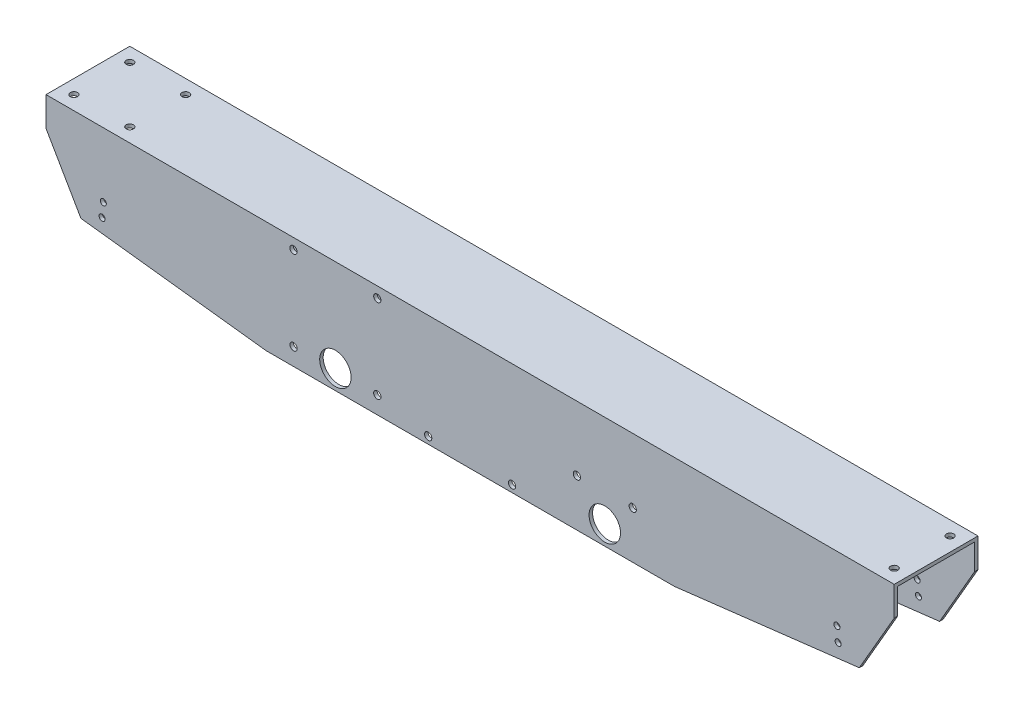
from build123d import *

# Parameters (mm, degrees)
BOSS_EXTRUDE1_DEPTH                     = 385.705756272
SKETCH2_R                               = 2.749999961
SKETCH2_R_2                             = 2.75
SKETCH2_R_3                             = 3.302
SKETCH2_R_4                             = 14.2875
AXLES_DEPTH                             = 141.732
FLANIGAN_MOUNTING_HOLES_R               = 3.3
FLANIGAN_MOUNTING_HOLES_EXTRUSION_DEPTH = 397.429073633
BEVELED_ENDS_DEPTH                      = 101.6
SKETCH32_R                              = 3.3
BELT_SHIELD_HOLES_DEPTH                 = 397.429073633
SKETCH37_R                              = 3.3
TOP_HOLES_DEPTH                         = 401.678300412


with BuildPart() as part:
    # Sketch1 → Boss-Extrude1 (new, symmetric)
    with BuildSketch(Plane(origin=(0, 0, 0), x_dir=(0, 0, -1), z_dir=(1, 0, 0))):
        Polygon((-38.1, 50.8), (38.1, 50.8), (38.1, -50.8), (34.925, -50.8), (34.925, 47.625), (-34.925, 47.625), (-34.925, -50.8), (-38.1, -50.8), align=None)
    extrude(amount=BOSS_EXTRUDE1_DEPTH, both=True)

    # Sketch2 → Axles (cut)
    with BuildSketch(Plane.XY.offset(38.1)):
        with Locations((-333.577237048, -7.874)):
            Circle(SKETCH2_R)
        with Locations((334.720333616, -20.574)):
            Circle(SKETCH2_R_2)
        with Locations((333.577237048, -7.874)):
            Circle(SKETCH2_R)
        with Locations((-160.6, -35.12)):
            Circle(SKETCH2_R_3)
        with Locations((-160.6, 41.08)):
            Circle(SKETCH2_R_3)
        with Locations((-122.5, -33.274)):
            Circle(SKETCH2_R_4)
        with Locations((-334.720333616, -20.574)):
            Circle(SKETCH2_R_2)
        with Locations((-84.4, 41.08)):
            Circle(SKETCH2_R_3)
        with Locations((-84.4, -35.12)):
            Circle(SKETCH2_R_3)
        with Locations((122.5, -33.274)):
            Circle(SKETCH2_R_4)
    extrude(amount=-AXLES_DEPTH, mode=Mode.SUBTRACT)

    # Flanigan mounting holes → Flanigan mounting holes extrusion (cut, through all)
    with BuildSketch(Plane.XY.offset(38.1)):
        with Locations((97.1, -7.87)):
            Circle(FLANIGAN_MOUNTING_HOLES_R)
        with Locations((147.9, -7.87)):
            Circle(FLANIGAN_MOUNTING_HOLES_R)
    extrude(amount=-FLANIGAN_MOUNTING_HOLES_EXTRUSION_DEPTH, mode=Mode.SUBTRACT)

    # Sketch16 → Beveled ends (cut)
    with BuildSketch(Plane.XY.offset(38.1)):
        Polygon((-353.951491467, -30.8), (-185.705756272, -50.8), (-385.705756272, -50.8), (-385.705756272, 24.2), align=None)
        Polygon((385.705756272, -50.8), (185.705756272, -50.8), (353.951491467, -30.8), (385.705756272, 24.2), align=None)
    extrude(amount=-BEVELED_ENDS_DEPTH, mode=Mode.SUBTRACT)

    # Sketch32 → Belt shield holes (cut, through all)
    with BuildSketch(Plane(origin=(0, 0, -38.1), x_dir=(-1, 0, 0), z_dir=(0, 0, -1))):
        with Locations((-38.1, -44.45)):
            Circle(SKETCH32_R)
        with Locations((38.1, -44.45)):
            Circle(SKETCH32_R)
    extrude(amount=-BELT_SHIELD_HOLES_DEPTH, mode=Mode.SUBTRACT)

    # Sketch37 → Top holes (cut, through all)
    with BuildSketch(Plane(origin=(0, 50.8, 0), x_dir=(1, 0, 0), z_dir=(0, 1, 0))):
        with Locations((373.005756272, 25.4)):
            Circle(SKETCH37_R)
        with Locations((373.005756272, -25.4)):
            Circle(SKETCH37_R)
        with Locations((-322.205756272, 25.4)):
            Circle(SKETCH37_R)
        with Locations((-322.205756272, -25.4)):
            Circle(SKETCH37_R)
        with Locations((-373.005756272, 25.4)):
            Circle(SKETCH37_R)
        with Locations((-373.005756272, -25.4)):
            Circle(SKETCH37_R)
    extrude(amount=-TOP_HOLES_DEPTH, mode=Mode.SUBTRACT)


solid = part.part
